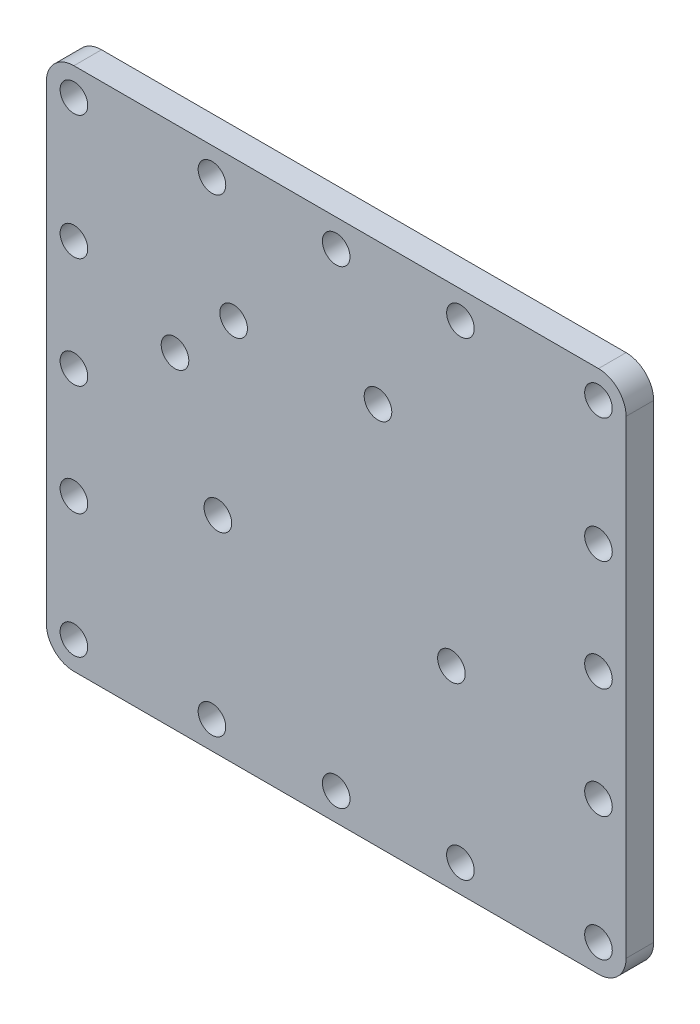
from build123d import *

# Parameters (mm, degrees)
SKETCH_1_R          = 5
EXTRUDE_1_DEPTH     = 5
SKETCH_2_W          = 135
SKETCH_2_H          = 125
CUT_EXTRUDE_1_DEPTH = 1
CUT_EXTRUDE_2_DEPTH = 1.5


with BuildPart() as part:
    # 草图1 → 凸台-拉伸1 (new, symmetric)
    with BuildSketch(Plane.XY):
        with BuildLine():
            Line((-95, -95), (95, -95))
            ThreePointArc((95, -95), (102.071067812, -92.071067812), (105, -85))
            Line((105, -85), (105, 85))
            ThreePointArc((105, 85), (102.071067812, 92.071067812), (95, 95))
            Line((95, 95), (-95, 95))
            ThreePointArc((-95, 95), (-102.071067812, 92.071067812), (-105, 85))
            Line((-105, 85), (-105, -85))
            ThreePointArc((-105, -85), (-102.071067812, -92.071067812), (-95, -95))
        make_face()
        with Locations((-95, 85)):
            Circle(SKETCH_1_R, mode=Mode.SUBTRACT)
        with Locations((95, 85)):
            Circle(SKETCH_1_R, mode=Mode.SUBTRACT)
        with Locations((95, -85)):
            Circle(SKETCH_1_R, mode=Mode.SUBTRACT)
        with Locations((-95, -85)):
            Circle(SKETCH_1_R, mode=Mode.SUBTRACT)
        with Locations((-37.156030243, 43.920850966)):
            Circle(SKETCH_1_R, mode=Mode.SUBTRACT)
        with Locations((15.145121023, 43.920850966)):
            Circle(SKETCH_1_R, mode=Mode.SUBTRACT)
        with Locations((-58.386061631, 23.270870328)):
            Circle(SKETCH_1_R, mode=Mode.SUBTRACT)
        with Locations((-42.862802557, -19.941076014)):
            Circle(SKETCH_1_R, mode=Mode.SUBTRACT)
        with Locations((41.733222374, -24.941076014)):
            Circle(SKETCH_1_R, mode=Mode.SUBTRACT)
        with Locations((95, 0)):
            Circle(SKETCH_1_R, mode=Mode.SUBTRACT)
        with Locations((95, 40)):
            Circle(SKETCH_1_R, mode=Mode.SUBTRACT)
        with Locations((95, -40)):
            Circle(SKETCH_1_R, mode=Mode.SUBTRACT)
        with Locations((-95, -40)):
            Circle(SKETCH_1_R, mode=Mode.SUBTRACT)
        with Locations((-95, 0)):
            Circle(SKETCH_1_R, mode=Mode.SUBTRACT)
        with Locations((-95, 40)):
            Circle(SKETCH_1_R, mode=Mode.SUBTRACT)
        with Locations((0, 85)):
            Circle(SKETCH_1_R, mode=Mode.SUBTRACT)
        with Locations((-45, 85)):
            Circle(SKETCH_1_R, mode=Mode.SUBTRACT)
        with Locations((45, 85)):
            Circle(SKETCH_1_R, mode=Mode.SUBTRACT)
        with Locations((45, -85)):
            Circle(SKETCH_1_R, mode=Mode.SUBTRACT)
        with Locations((0, -85)):
            Circle(SKETCH_1_R, mode=Mode.SUBTRACT)
        with Locations((-45, -85)):
            Circle(SKETCH_1_R, mode=Mode.SUBTRACT)
    extrude(amount=EXTRUDE_1_DEPTH, both=True)

    # 草图2 → 切除-拉伸1 (cut)
    with BuildSketch(Plane(origin=(0, 0, -5), x_dir=(-1, 0, 0), z_dir=(0, 0, -1))):
        Rectangle(SKETCH_2_W, SKETCH_2_H)
    extrude(amount=-CUT_EXTRUDE_1_DEPTH, mode=Mode.SUBTRACT)

    # 草图3 → 切除-拉伸2 (cut)
    with BuildSketch(Plane(origin=(0, 0, -5), x_dir=(-1, 0, 0), z_dir=(0, 0, -1))):
        with BuildLine():
            Line((-69.5, -67), (69.5, -67))
            ThreePointArc((69.5, -67), (73.035533906, -65.535533906), (74.5, -62))
            Line((74.5, -62), (74.5, 62))
            ThreePointArc((74.5, 62), (73.035533906, 65.535533906), (69.5, 67))
            Line((69.5, 67), (-69.5, 67))
            ThreePointArc((-69.5, 67), (-73.035533906, 65.535533906), (-74.5, 62))
            Line((-74.5, 62), (-74.5, -62))
            ThreePointArc((-74.5, -62), (-73.035533906, -65.535533906), (-69.5, -67))
        make_face()
        with BuildLine():
            Line((-67.5, -65), (67.5, -65))
            ThreePointArc((67.5, -65), (71.035533906, -63.535533906), (72.5, -60))
            Line((72.5, -60), (72.5, 60))
            ThreePointArc((72.5, 60), (71.035533906, 63.535533906), (67.5, 65))
            Line((67.5, 65), (-67.5, 65))
            ThreePointArc((-67.5, 65), (-71.035533906, 63.535533906), (-72.5, 60))
            Line((-72.5, 60), (-72.5, -60))
            ThreePointArc((-72.5, -60), (-71.035533906, -63.535533906), (-67.5, -65))
        make_face(mode=Mode.SUBTRACT)
    extrude(amount=-CUT_EXTRUDE_2_DEPTH, mode=Mode.SUBTRACT)


solid = part.part
